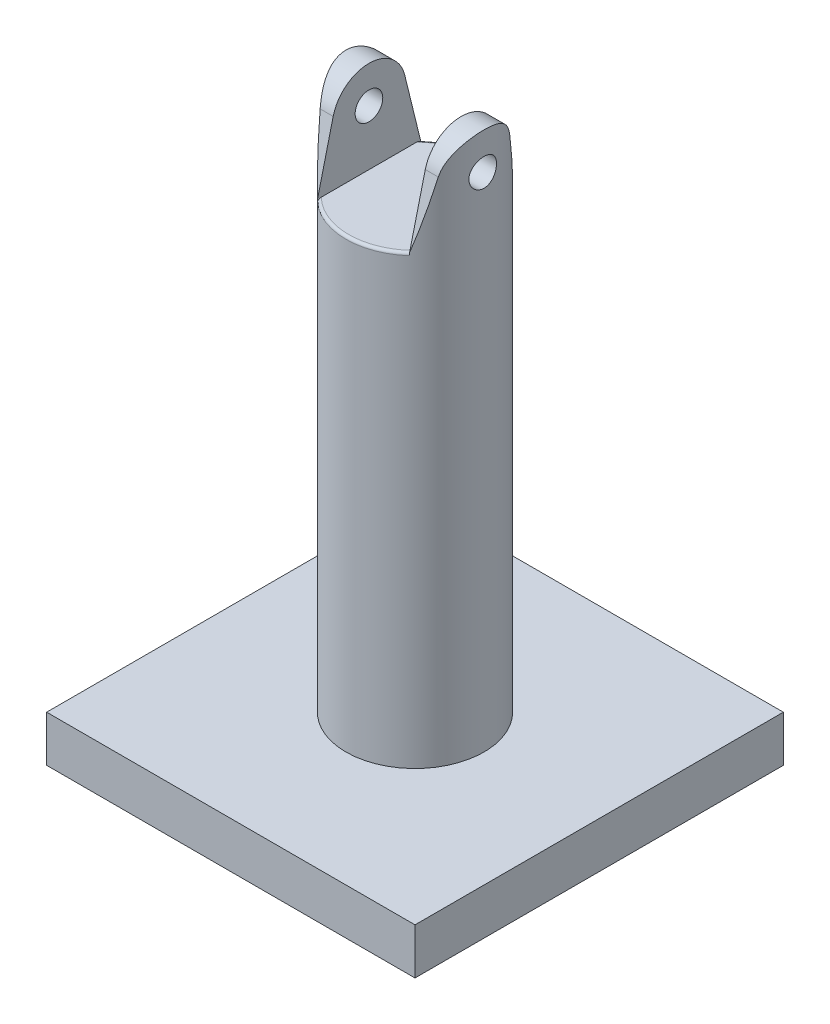
from build123d import *

# Parameters (mm, degrees)
CROQUIS1_R                 = 7.5
SALIENTE_EXTRUIR1_DEPTH    = 58.52
CROQUIS2_W                 = 10
CROQUIS2_H                 = 15.856290926
CORTAR_EXTRUIR1_DEPTH      = 10
CORTAR_EXTRUIR2_DEPTH      = 60.473442813
CORTAR_EXTRUIR2_DEPTH_BACK = 60.473442813
CORTAR_EXTRUIR3_DEPTH      = 60.473442936
CORTAR_EXTRUIR3_DEPTH_BACK = 60.473442936
CROQUIS4_R                 = 1.5
REDONDEO1_R                = 0.3
CROQUIS6_W                 = 40
CROQUIS6_H                 = 40
SALIENTE_EXTRUIR2_DEPTH    = 5


with BuildPart() as part:
    # Croquis1 → Saliente-Extruir1 (new body)
    with BuildSketch(Plane(origin=(0, 0, 0), x_dir=(1, 0, 0), z_dir=(0, 1, 0))):
        with Locations(Location((0, 0, 0), (0, 0, 270))):
            Circle(CROQUIS1_R)
    extrude(amount=SALIENTE_EXTRUIR1_DEPTH)

    # Croquis2 → Cortar-Extruir1 (cut)
    with BuildSketch(Plane(origin=(0, 58.52, 0), x_dir=(1, 0, 0), z_dir=(0, 1, 0))):
        Rectangle(CROQUIS2_W, CROQUIS2_H)
    extrude(amount=-CORTAR_EXTRUIR1_DEPTH, mode=Mode.SUBTRACT)

    # Croquis3 → Cortar-Extruir2 (cut, two sides: drawn at the far end of the back side and taken through both)
    with BuildSketch(Plane(origin=(0, 0, 0), x_dir=(0, 0, -1), z_dir=(1, 0, 0)).offset(-CORTAR_EXTRUIR2_DEPTH_BACK)):
        with BuildLine():
            Line((-119.071460559, 48.52), (-7.5, 48.52))
            Line((-7.5, 48.52), (-5.590169944, 48.52))
            Line((-5.590169944, 48.52), (-3.884856087, 55.472834289))
            ThreePointArc((-3.884856087, 55.472834289), (0.002300645, 58.519999338), (3.885949583, 55.468364822))
            Line((3.885949583, 55.468364822), (5.590169944, 48.52))
            Line((5.590169944, 48.52), (7.5, 48.52))
            Line((7.5, 48.52), (119.071460559, 48.52))
            Line((119.071460559, 48.52), (119.071460559, 271.662921117))
            Line((119.071460559, 271.662921117), (-119.071460559, 271.662921117))
            Line((-119.071460559, 271.662921117), (-119.071460559, 48.52))
        make_face()
    extrude(amount=CORTAR_EXTRUIR2_DEPTH + CORTAR_EXTRUIR2_DEPTH_BACK, mode=Mode.SUBTRACT)

    # Croquis4 → Cortar-Extruir3 (cut, two sides: drawn at the far end of the back side and taken through both)
    with BuildSketch(Plane(origin=(0, 0, 0), x_dir=(0, 0, -1), z_dir=(1, 0, 0)).offset(-CORTAR_EXTRUIR3_DEPTH_BACK)):
        with Locations((0, 54.52)):
            Circle(CROQUIS4_R)
    extrude(amount=CORTAR_EXTRUIR3_DEPTH + CORTAR_EXTRUIR3_DEPTH_BACK, mode=Mode.SUBTRACT)

    # Redondeo1
    # the kernel refuses this fillet: 0.3 mm, written as the material it takes off along each edge
    with BuildSketch(Plane(origin=(0, 48.52, 0), x_dir=(0.7377533967735658, 0, 0.6750703115595187), z_dir=(0.6750703115595187, 0, -0.7377533967735658))) as redondeo1_piece_1_section:
        with BuildLine():
            CenterArc((7.5 - REDONDEO1_R, REDONDEO1_R), REDONDEO1_R, 270, 90)
            Line((7.5 - REDONDEO1_R, 0), (7.5, 0))
            Line((7.5, 0), (7.5, REDONDEO1_R))
        make_face()
    redondeo1_piece_1 = revolve(axis=Axis((0, 48.52, 0), (0, -1, 0)), revolution_arc=47.540389462, mode=Mode.PRIVATE)
    redondeo1_piece_1 = split(redondeo1_piece_1, bisect_by=Plane(origin=(5, 48.469281218, 5.527384127), z_dir=(-1, 0, 0)), keep=Keep.TOP, mode=Mode.PRIVATE)
    add(redondeo1_piece_1, mode=Mode.SUBTRACT)
    with BuildSketch(Plane(origin=(0, 48.52, 0), x_dir=(-0.7377709544179419, 0, -0.675051123113827), z_dir=(-0.675051123113827, 0, 0.7377709544179419))) as redondeo1_piece_2_section:
        with BuildLine():
            CenterArc((7.5 - REDONDEO1_R, REDONDEO1_R), REDONDEO1_R, 270, 90)
            Line((7.5 - REDONDEO1_R, 0), (7.5, 0))
            Line((7.5, 0), (7.5, REDONDEO1_R))
        make_face()
    redondeo1_piece_2 = revolve(axis=Axis((0, 48.52, 0), (0, -1, 0)), revolution_arc=95.083759333, mode=Mode.PRIVATE)
    redondeo1_piece_2 = split(redondeo1_piece_2, bisect_by=Plane(origin=(-5, 48.469281136, -5.527384204), z_dir=(1, 0, 0)), keep=Keep.TOP, mode=Mode.PRIVATE)
    redondeo1_piece_2 = split(redondeo1_piece_2, bisect_by=Plane(origin=(5, 48.469281136, -5.527384204), z_dir=(-1, 0, 0)), keep=Keep.TOP, mode=Mode.PRIVATE)
    add(redondeo1_piece_2, mode=Mode.SUBTRACT)
    with BuildSketch(Plane(origin=(0, 48.52, 0), x_dir=(0, 0, 1), z_dir=(1, 0, 0))) as redondeo1_piece_3_section:
        with BuildLine():
            CenterArc((7.5 - REDONDEO1_R, REDONDEO1_R), REDONDEO1_R, 270, 90)
            Line((7.5 - REDONDEO1_R, 0), (7.5, 0))
            Line((7.5, 0), (7.5, REDONDEO1_R))
        make_face()
    redondeo1_piece_3 = revolve(axis=Axis((0, 48.52, 0), (0, -1, 0)), revolution_arc=47.540389462, mode=Mode.PRIVATE)
    redondeo1_piece_3 = split(redondeo1_piece_3, bisect_by=Plane(origin=(-5, 48.435444693, 6.94366102), z_dir=(1, 0, 0)), keep=Keep.TOP, mode=Mode.PRIVATE)
    add(redondeo1_piece_3, mode=Mode.SUBTRACT)

    # Croquis6 → Saliente-Extruir2 (add)
    with BuildSketch(Plane.XZ):
        Rectangle(CROQUIS6_W, CROQUIS6_H)
    extrude(amount=SALIENTE_EXTRUIR2_DEPTH)


solid = part.part
